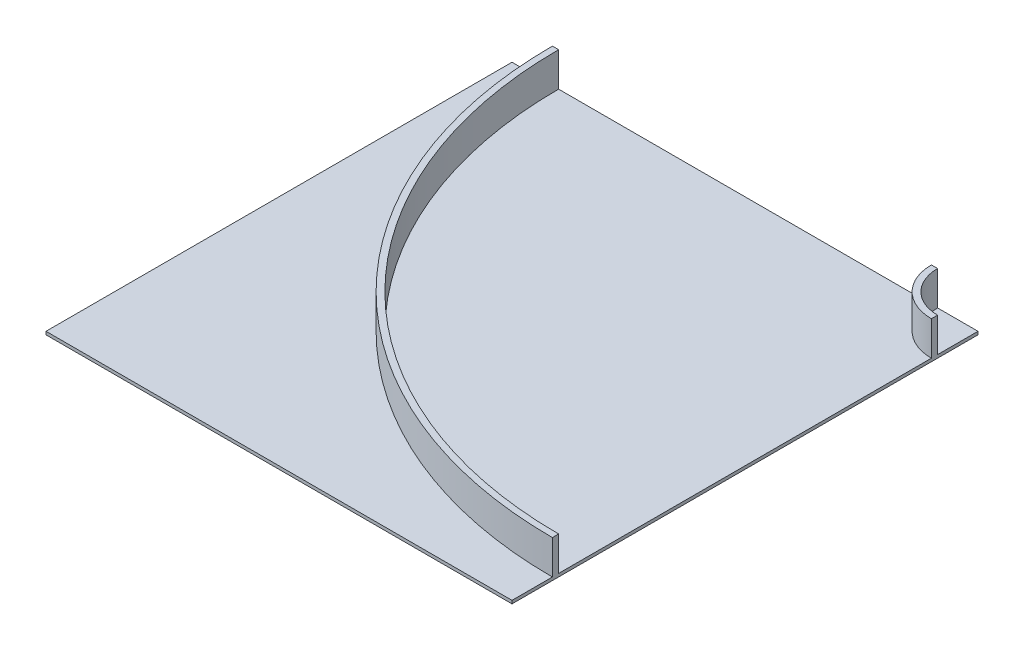
from build123d import *

# Parameters (mm, degrees)
SKETCH2_W           = 1500
SKETCH2_H           = 1500
BOSS_EXTRUDE1_DEPTH = 10
BOSS_EXTRUDE2_DEPTH = 110


with BuildPart() as part:
    # Sketch2 → Boss-Extrude1 (new body)
    with BuildSketch(Plane(origin=(0, 0, 0), x_dir=(1, 0, 0), z_dir=(0, 1, 0))):
        Rectangle(SKETCH2_W, SKETCH2_H)
    extrude(amount=BOSS_EXTRUDE1_DEPTH)

    # Sketch3 → Boss-Extrude2 (add)
    with BuildSketch(Plane(origin=(0, 10, 0), x_dir=(1, 0, 0), z_dir=(0, 1, 0))):
        with BuildLine():
            Line((620, 750), (600, 750))
            ThreePointArc((600, 750), (643.933982822, 643.933982822), (750, 600))
            Line((750, 600), (750, 620))
            ThreePointArc((750, 620), (658.076118446, 658.076118446), (620, 750))
        make_face()
        with BuildLine():
            ThreePointArc((750, -600), (-204.594154602, -204.594154602), (-600, 750))
            Line((-600, 750), (-620, 750))
            ThreePointArc((-620, 750), (-218.736290226, -218.736290226), (750, -620))
            Line((750, -620), (750, -600))
        make_face()
    extrude(amount=BOSS_EXTRUDE2_DEPTH)


solid = part.part
